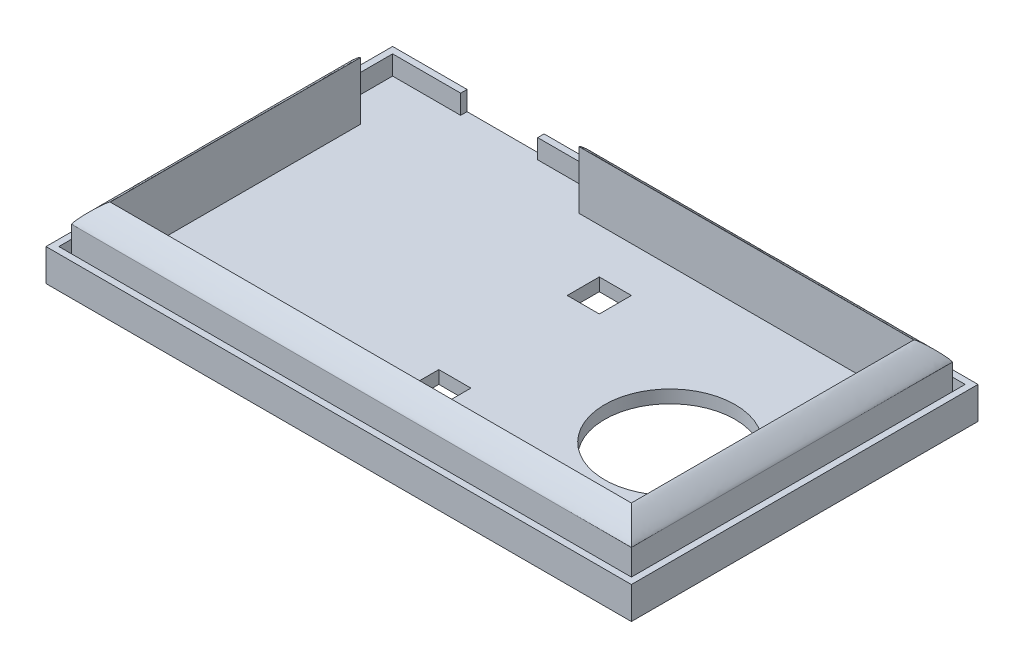
from build123d import *

# Parameters (mm, degrees)
CROQUIS1_W              = 91.2
CROQUIS1_H              = 54
SALIENTE_EXTRUIR1_DEPTH = 2
CROQUIS2_W              = 91.2
CROQUIS2_H              = 54
CROQUIS2_W_2            = 89.2
CROQUIS2_H_2            = 52
SALIENTE_EXTRUIR2_DEPTH = 3
CROQUIS3_W              = 87.2
CROQUIS3_H              = 50
CROQUIS3_W_2            = 81.2
CROQUIS3_H_2            = 44
SALIENTE_EXTRUIR3_DEPTH = 9
REDONDEO1_SIZE          = 3
CROQUIS4_W              = 32
CROQUIS4_H              = 8
CORTAR_EXTRUIR2_DEPTH   = 28
CROQUIS5_R              = 10.16
CROQUIS5_W              = 5
CROQUIS5_H              = 5
CORTAR_EXTRUIR3_DEPTH   = 28
CROQUIS6_W              = 12
CROQUIS6_H              = 6
CORTAR_EXTRUIR4_DEPTH   = 7


with BuildPart() as part:
    # Croquis1 → Saliente-Extruir1 (new body)
    with BuildSketch(Plane(origin=(0, 0, 0), x_dir=(1, 0, 0), z_dir=(0, 1, 0))):
        Rectangle(CROQUIS1_W, CROQUIS1_H)
    extrude(amount=SALIENTE_EXTRUIR1_DEPTH)

    # Croquis2 → Saliente-Extruir2 (add)
    with BuildSketch(Plane(origin=(0, 2, 0), x_dir=(1, 0, 0), z_dir=(0, 1, 0))):
        Rectangle(CROQUIS2_W, CROQUIS2_H)
        Rectangle(CROQUIS2_W_2, CROQUIS2_H_2, mode=Mode.SUBTRACT)
    extrude(amount=SALIENTE_EXTRUIR2_DEPTH)

    # Croquis3 → Saliente-Extruir3 (add)
    with BuildSketch(Plane(origin=(0, 2, 0), x_dir=(1, 0, 0), z_dir=(0, 1, 0))):
        Rectangle(CROQUIS3_W, CROQUIS3_H)
        Rectangle(CROQUIS3_W_2, CROQUIS3_H_2, mode=Mode.SUBTRACT)
    extrude(amount=SALIENTE_EXTRUIR3_DEPTH)

    # Redondeo1
    # a fillet whose section is not a circle: 3 mm, written as the material it takes off along each edge
    with BuildSketch(Plane(origin=(51.1, 11, -25), x_dir=(0, -1, 0), z_dir=(-1, 0, 0)), Plane(origin=(-51.1, 11, 25), x_dir=(0, -1, 0), z_dir=(1, 0, 0))) as redondeo1_piece_1:
        with BuildLine():
            Bezier((REDONDEO1_SIZE, 0), (0, 0), (0, REDONDEO1_SIZE), weights=[1, 0.111111111, 1])
            Line((0, REDONDEO1_SIZE), (0, 0))
            Line((0, 0), (REDONDEO1_SIZE, 0))
        make_face()
    extrude(amount=102.2, mode=Mode.SUBTRACT)
    with BuildSketch(Plane(origin=(43.6, 11, 32.5), x_dir=(0, -1, 0), z_dir=(0, 0, -1)), Plane(origin=(-43.6, 11, -32.5), x_dir=(0, -1, 0), z_dir=(0, 0, 1))) as redondeo1_piece_2:
        with BuildLine():
            Bezier((REDONDEO1_SIZE, 0), (0, 0), (0, REDONDEO1_SIZE), weights=[1, 0.111111111, 1])
            Line((0, REDONDEO1_SIZE), (0, 0))
            Line((0, 0), (REDONDEO1_SIZE, 0))
        make_face()
    extrude(amount=65, mode=Mode.SUBTRACT)

    # Croquis4 → Cortar-Extruir2 (cut)
    with BuildSketch(Plane(origin=(0, 2, 0), x_dir=(1, 0, 0), z_dir=(0, 1, 0))):
        with Locations((-27.6, 21)):
            Rectangle(CROQUIS4_W, CROQUIS4_H)
    extrude(amount=CORTAR_EXTRUIR2_DEPTH, mode=Mode.SUBTRACT)

    # Croquis5 → Cortar-Extruir3 (cut)
    with BuildSketch(Plane.XZ):
        with Locations(Location((26.4, 1.8, 0), (0, 0, 270))):
            Circle(CROQUIS5_R)
        with Locations((1.1, 12.5)):
            Rectangle(CROQUIS5_W, CROQUIS5_H)
        with Locations((1.1, -12.5)):
            Rectangle(CROQUIS5_W, CROQUIS5_H)
    extrude(amount=-CORTAR_EXTRUIR3_DEPTH, mode=Mode.SUBTRACT)

    # Croquis6 → Cortar-Extruir4 (cut)
    with BuildSketch(Plane(origin=(0, 0, -27), x_dir=(-1, 0, 0), z_dir=(0, 0, -1))):
        with Locations((28, 5)):
            Rectangle(CROQUIS6_W, CROQUIS6_H)
    extrude(amount=-CORTAR_EXTRUIR4_DEPTH, mode=Mode.SUBTRACT)


solid = part.part
